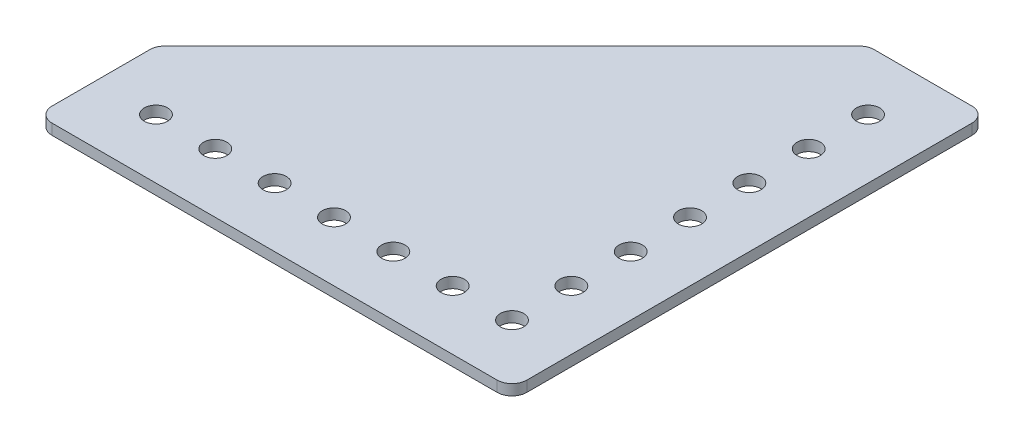
from build123d import *

# Parameters (mm, degrees)
SKETCH1_R           = 2.4892
BOSS_EXTRUDE2_DEPTH = 1.143
FILLET1_R           = 3.175
FILLET2_R           = 3.175


with BuildPart() as part:
    # Sketch1 → Boss-Extrude2 (new, symmetric)
    with BuildSketch(Plane(origin=(0, 0, 0), x_dir=(1, 0, 0), z_dir=(0, 1, 0))):
        Polygon((0, 0), (0, 101.6), (-25.4, 101.6), (-101.6, 25.4), (-101.6, 0), align=None)
        with Locations((-12.7, 12.7)):
            Circle(SKETCH1_R, mode=Mode.SUBTRACT)
        with Locations((-25.4, 12.7)):
            Circle(SKETCH1_R, mode=Mode.SUBTRACT)
        with Locations((-38.1, 12.7)):
            Circle(SKETCH1_R, mode=Mode.SUBTRACT)
        with Locations((-50.8, 12.7)):
            Circle(SKETCH1_R, mode=Mode.SUBTRACT)
        with Locations((-63.5, 12.7)):
            Circle(SKETCH1_R, mode=Mode.SUBTRACT)
        with Locations((-12.7, 25.4)):
            Circle(SKETCH1_R, mode=Mode.SUBTRACT)
        with Locations((-12.7, 38.1)):
            Circle(SKETCH1_R, mode=Mode.SUBTRACT)
        with Locations((-12.7, 50.8)):
            Circle(SKETCH1_R, mode=Mode.SUBTRACT)
        with Locations((-12.7, 63.5)):
            Circle(SKETCH1_R, mode=Mode.SUBTRACT)
        with Locations((-76.2, 12.7)):
            Circle(SKETCH1_R, mode=Mode.SUBTRACT)
        with Locations((-88.9, 12.7)):
            Circle(SKETCH1_R, mode=Mode.SUBTRACT)
        with Locations((-12.7, 88.9)):
            Circle(SKETCH1_R, mode=Mode.SUBTRACT)
        with Locations((-12.7, 76.2)):
            Circle(SKETCH1_R, mode=Mode.SUBTRACT)
    extrude(amount=BOSS_EXTRUDE2_DEPTH, both=True)

    # Fillet1
    fillet1_edges = [part.edges().sort_by_distance(p)[0] for p in [
        (0, 0, 0),
        (-101.6, 0, 0),
    ]]
    fillet(fillet1_edges, radius=FILLET1_R)

    # Fillet2
    fillet2_edges = [part.edges().sort_by_distance(p)[0] for p in [
        (-101.6, 0, -25.4),
        (0, 0, -101.6),
        (-25.4, 0, -101.6),
    ]]
    fillet(fillet2_edges, radius=FILLET2_R)


solid = part.part
